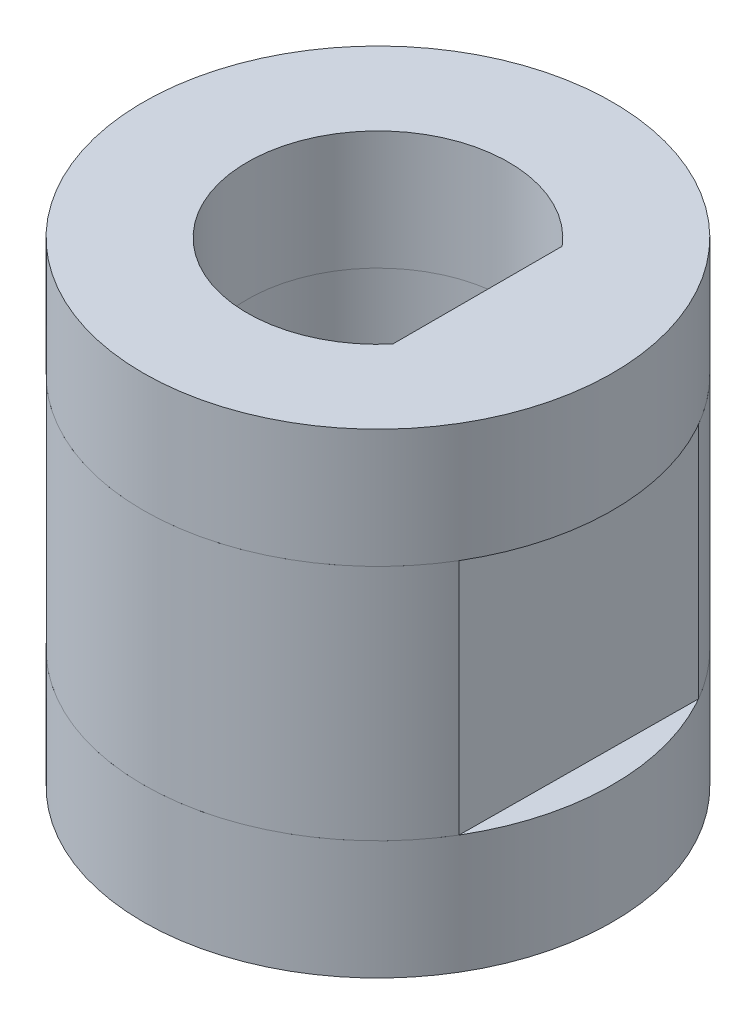
from build123d import *

# Parameters (mm, degrees)
SKETCH1_R           = 3.95
BOSS_EXTRUDE1_DEPTH = 2
BOSS_EXTRUDE2_DEPTH = 4
SKETCH4_R           = 3.95
BOSS_EXTRUDE3_DEPTH = 2
CUT_EXTRUDE1_DEPTH  = 10.757304956


with BuildPart() as part:
    # Sketch1 → Boss-Extrude1 (new body)
    with BuildSketch(Plane(origin=(0, 0, 0), x_dir=(1, 0, 0), z_dir=(0, 1, 0))):
        Circle(SKETCH1_R)
    extrude(amount=BOSS_EXTRUDE1_DEPTH)


with BuildPart() as body_2:
    # Sketch3 → Boss-Extrude2 (new body)
    with BuildSketch(Plane(origin=(0, 2, 0), x_dir=(1, 0, 0), z_dir=(0, 1, 0))):
        with BuildLine():
            Line((-2.025641026, 3.391058601), (1.974358974, 3.421170361))
            ThreePointArc((1.974358974, 3.421170361), (2.793071786, 2.793071786), (3.421170361, 1.974358974))
            Line((3.421170361, 1.974358974), (3.391058601, -2.025641026))
            ThreePointArc((3.391058601, -2.025641026), (-2.793071786, -2.793071786), (-2.025641026, 3.391058601))
        make_face()
    extrude(amount=BOSS_EXTRUDE2_DEPTH)


with BuildPart() as body_3:
    # Sketch4 → Boss-Extrude3 (new body)
    with BuildSketch(Plane(origin=(0, 6, 0), x_dir=(1, 0, 0), z_dir=(0, 1, 0))):
        Circle(SKETCH4_R)
    extrude(amount=BOSS_EXTRUDE3_DEPTH)


with BuildPart() as cut_extrude1_tool:
    # Sketch5 → Cut-Extrude1 (new, through all)
    with BuildSketch(Plane(origin=(0, 8, 0), x_dir=(1, 0, 0), z_dir=(0, 1, 0))):
        with BuildLine():
            Line((1.676190476, 1.424915958), (1.676190476, -1.424915958))
            ThreePointArc((1.676190476, -1.424915958), (-2.2, 0), (1.676190476, 1.424915958))
        make_face()
    extrude(amount=-CUT_EXTRUDE1_DEPTH)


with BuildPart() as part_1:
    add(part.part)

    # Cut-Extrude1: cut by cut_extrude1_tool
    add(cut_extrude1_tool.part, mode=Mode.SUBTRACT)


with BuildPart() as body_2_1:
    add(body_2.part)

    # Cut-Extrude1: cut by cut_extrude1_tool
    add(cut_extrude1_tool.part, mode=Mode.SUBTRACT)


with BuildPart() as body_3_1:
    add(body_3.part)

    # Cut-Extrude1: cut by cut_extrude1_tool
    add(cut_extrude1_tool.part, mode=Mode.SUBTRACT)


solid = Compound([part_1.part, body_2_1.part, body_3_1.part])
